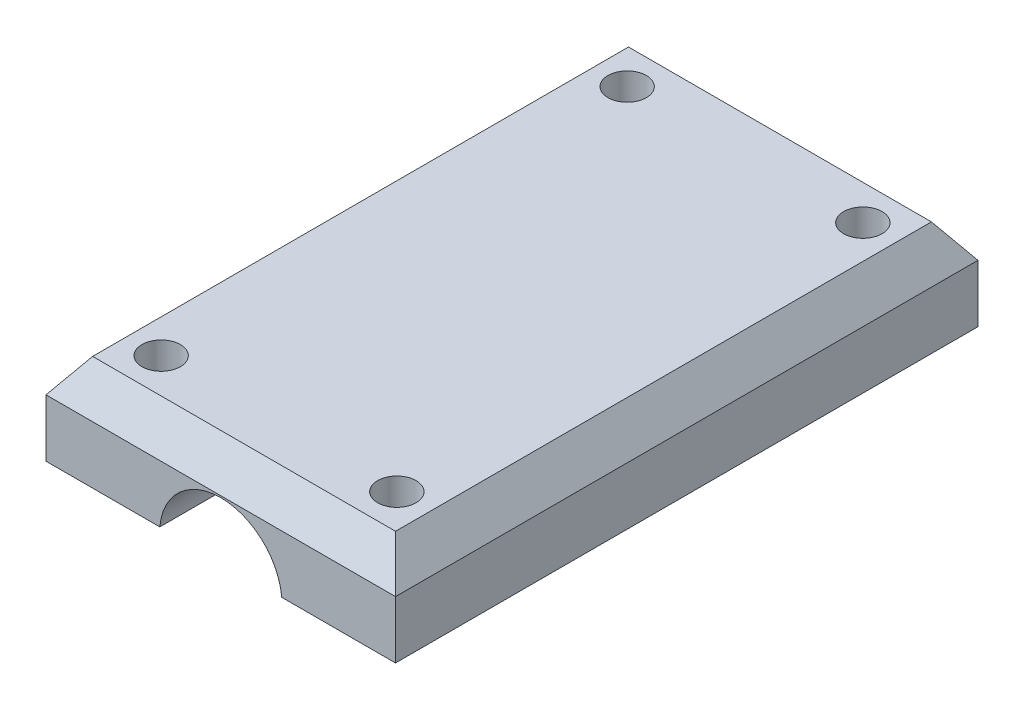
from build123d import *
from OCP.BRepAlgoAPI import BRepAlgoAPI_Cut
from OCP.TopTools import TopTools_ListOfShape

# Parameters (mm, degrees)
BOSS_EXTRUDE1_DEPTH = 50
SKETCH4_R           = 1.65
CUT_EXTRUDE1_DEPTH  = 7.792432
CHAMFER1_SIZE       = 2
CHAMFER1_SIZE2      = 2.856296013


with BuildPart() as part:
    # Sketch2 → Boss-Extrude1 (new body)
    with BuildSketch(Plane.XY):
        with BuildLine():
            Line((5.230022165, 0), (15, 0))
            Line((15, 0), (15, 7.792432351))
            Line((15, 7.792432351), (-15, 7.792432351))
            Line((-15, 7.792432351), (-15, 0))
            Line((-15, 0), (-5.230022165, 0))
            ThreePointArc((-5.230022165, 0), (0, 4.792432351), (5.230022165, 0))
        make_face()
    extrude(amount=-BOSS_EXTRUDE1_DEPTH)


with BuildPart() as cut_extrude1_tool:
    # Sketch4 → Cut-Extrude1 (new body)
    with BuildSketch(Plane(origin=(0, 7.792432351, 0), x_dir=(1, 0, 0), z_dir=(0, 1, 0))):
        with Locations(Location((-10.115011082, 45, 0), (0, 0, 270))):
            Circle(SKETCH4_R)
        with Locations(Location((-10.115011082, 5, 0), (0, 0, 270))):
            Circle(SKETCH4_R)
        with Locations(Location((10.115011082, 45, 0), (0, 0, 270))):
            Circle(SKETCH4_R)
        with Locations(Location((10.115011082, 5, 0), (0, 0, 270))):
            Circle(SKETCH4_R)
    extrude(amount=-CUT_EXTRUDE1_DEPTH)


with BuildPart() as part_1:
    add(part.part)

    # Cut-Extrude1: cut by cut_extrude1_tool, with a tolerance
    cut_extrude1_stock = TopTools_ListOfShape()
    cut_extrude1_stock.Append(part_1.part.wrapped)
    cut_extrude1_tools = TopTools_ListOfShape()
    cut_extrude1_tools.Append(cut_extrude1_tool.part.wrapped)
    cut_extrude1_cut = BRepAlgoAPI_Cut()
    cut_extrude1_cut.SetArguments(cut_extrude1_stock)
    cut_extrude1_cut.SetTools(cut_extrude1_tools)
    cut_extrude1_cut.SetFuzzyValue(0.00001)
    cut_extrude1_cut.Build()
    add(Compound.cast(cut_extrude1_cut.Shape()).solids(), mode=Mode.REPLACE)

    # Chamfer1
    chamfer1_edges = [part_1.edges().sort_by_distance(p)[0] for p in [
        (0, 7.792432351, 0),
        (15, 7.792432351, -25),
        (0, 7.792432351, -50),
        (-15, 7.792432351, -25),
    ]]
    chamfer1_side = [part_1.faces().sort_by_distance(p)[0] for p in [
        (0, 7.792432351, -25),
    ]]
    chamfer(chamfer1_edges, length=CHAMFER1_SIZE, length2=CHAMFER1_SIZE2, reference=chamfer1_side[0])


solid = part_1.part
